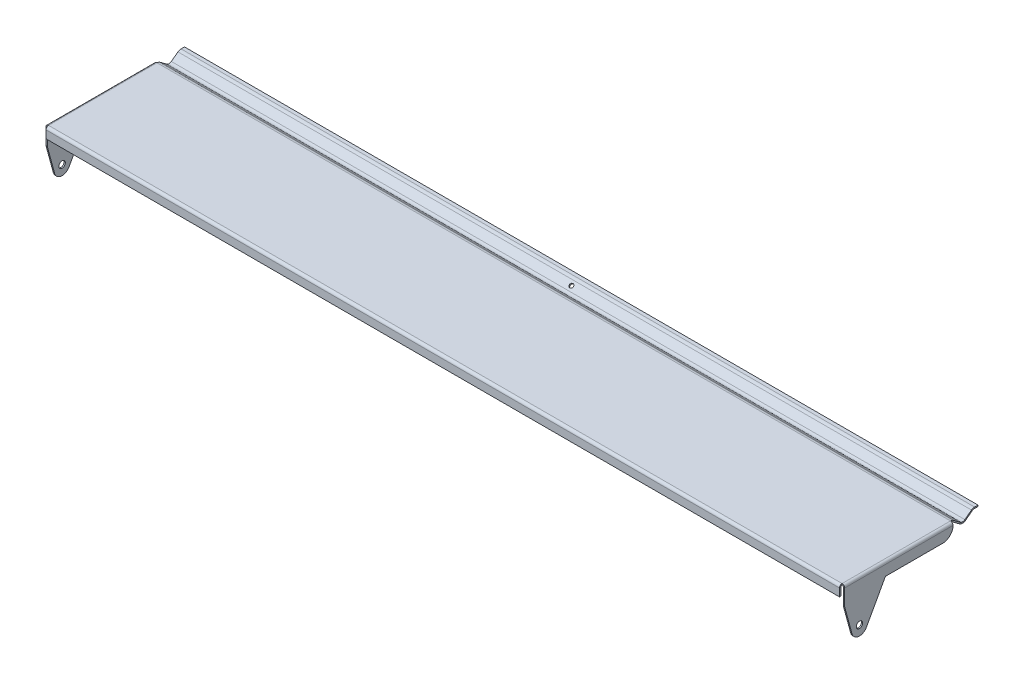
from build123d import *

# Parameters (mm, degrees)
SKETCH1_W                    = 615
SKETCH1_H                    = 105
BASE_FLANGE1_DEPTH           = 1
EDGE_FLANGE1_STRIP_W         = 6
EDGE_FLANGE1_STRIP_H         = 1
EDGE_FLANGE1_STRIP_CUT_DEPTH = 615
EDGE_FLANGE1_DEPTH           = 615
SKETCH16_W                   = 615
SKETCH16_H                   = 196.52545168
CUT_EXTRUDE1_DEPTH           = 10
SWEPT_START                  = -307.5
SWEPT_FLANGE1_DEPTH          = 615
EDGE_FLANGE2_DEPTH           = 84
EDGE_FLANGE2_BEND_DEPTH      = 84
CUT_EXTRUDE2_DEPTH           = 623.622700982
CUT_EXTRUDE2_DEPTH_BACK      = 623.622700982
SKETCH39_R                   = 2.5
FILLET1_R                    = 8
SKETCH45_R                   = 1.5
CUT_EXTRUDE3_DEPTH           = 10


# Read off the part's stored shape, not the designer's step: Swept Flange1
# Sheet-metal steps are written as plain solids
with BuildPart() as part:
    # Sketch1 → Base-Flange1 (new body)
    with BuildSketch(Plane(origin=(0, 0, 0), x_dir=(1, 0, 0), z_dir=(0, 1, 0))):
        Rectangle(SKETCH1_W, SKETCH1_H)
    extrude(amount=-BASE_FLANGE1_DEPTH)

    # Edge-Flange1 strip (across the edge) → Edge-Flange1 strip cut (cut)
    with BuildSketch(Plane(origin=(307.5, -1, 52.5), x_dir=(0, 0, -1), z_dir=(-1, 0, 0))):
        with Locations((-2, -0.5)):
            Rectangle(EDGE_FLANGE1_STRIP_W, EDGE_FLANGE1_STRIP_H)
    extrude(amount=EDGE_FLANGE1_STRIP_CUT_DEPTH, mode=Mode.SUBTRACT)

    # Edge-Flange1 section (across the edge) → Edge-Flange1 (add)
    with BuildSketch(Plane(origin=(307.5, -1, 52.5), x_dir=(0, 0, -1), z_dir=(-1, 0, 0))):
        with BuildLine():
            Line((-1, 1), (-1, 7))
            Line((-1, 7), (0, 7))
            Line((0, 7), (0, 1))
            ThreePointArc((0, 1), (0.292893219, 0.292893219), (1, 0))
            Line((1, 0), (1, -1))
            ThreePointArc((1, -1), (-0.414213562, -0.414213562), (-1, 1))
        make_face()
    extrude(amount=EDGE_FLANGE1_DEPTH)

    # Sketch16 → Cut-Extrude1 (cut)
    with BuildSketch(Plane(origin=(0, 0, 0), x_dir=(1, 0, 0), z_dir=(0, 1, 0))):
        with Locations((0, 130.76272584)):
            Rectangle(SKETCH16_W, SKETCH16_H)
    extrude(amount=-CUT_EXTRUDE1_DEPTH, mode=Mode.SUBTRACT)

    # Swept Flange1 outline → Swept Flange1 (add)
    with BuildSketch(Plane.YZ.offset(SWEPT_START)):
        with BuildLine():
            Line((-1, -51.166666667), (-1, -53.833333333))
            Line((-1, -53.833333333), (0, -53.833333333))
            Line((0, -53.833333333), (0, -51.166666667))
            ThreePointArc((0, -51.166666667), (-0.205266808, -49.901755603), (-0.8, -48.766666667))
            Line((-0.8, -48.766666667), (-4.65, -43.633333333))
            ThreePointArc((-4.65, -43.633333333), (-5.25, -41.833333333), (-4.65, -40.033333333))
            Line((-4.65, -40.033333333), (-0.8, -34.9))
            ThreePointArc((-0.8, -34.9), (-0.205266808, -33.764911064), (0, -32.5))
            Line((0, -32.5), (-1, -32.5))
            ThreePointArc((-1, -32.5), (-1.153950106, -33.448683298), (-1.6, -34.3))
            Line((-1.6, -34.3), (-5.45, -39.433333333))
            ThreePointArc((-5.45, -39.433333333), (-6.25, -41.833333333), (-5.45, -44.233333333))
            Line((-5.45, -44.233333333), (-1.6, -49.366666667))
            ThreePointArc((-1.6, -49.366666667), (-1.153950106, -50.217983369), (-1, -51.166666667))
        make_face()
    extrude(amount=SWEPT_FLANGE1_DEPTH)

    # Edge-Flange2 section (across the edge) → Edge-Flange2 (add)
    with BuildSketch(Plane(origin=(308.5, -1, -32.5), x_dir=(-1, 0, 0), z_dir=(0, 0, 1))):
        with BuildLine():
            Line((-1, 1), (-1, 39))
            Line((-1, 39), (0, 39))
            Line((0, 39), (0, 1))
            ThreePointArc((0, 1), (0.292893219, 0.292893219), (1, 0))
            Line((1, 0), (1, -1))
            ThreePointArc((1, -1), (-0.414213562, -0.414213562), (-1, 1))
        make_face()
    extrude(amount=EDGE_FLANGE2_DEPTH)

    # Edge-Flange2 section 2 (across the edge) → Edge-Flange2 bend (add)
    with BuildSketch(Plane(origin=(-308.5, -1, 51.5), x_dir=(1, 0, 0), z_dir=(0, 0, -1))):
        with BuildLine():
            Line((-1, 1), (-1, 39))
            Line((-1, 39), (0, 39))
            Line((0, 39), (0, 1))
            ThreePointArc((0, 1), (0.292893219, 0.292893219), (1, 0))
            Line((1, 0), (1, -1))
            ThreePointArc((1, -1), (-0.414213562, -0.414213562), (-1, 1))
        make_face()
    extrude(amount=EDGE_FLANGE2_BEND_DEPTH)

    # Sketch39 → Cut-Extrude2 (cut, two sides: drawn at the far end of the back side and taken through both)
    with BuildSketch(Plane.ZY.offset(309.5).offset(-CUT_EXTRUDE2_DEPTH_BACK)):
        with Locations(Location((40, -32.5, 0), (0, 0, 90))):
            Circle(SKETCH39_R)
        with BuildLine():
            Line((-32.5, -10), (19.901558991, -10))
            Line((19.901558991, -10), (34.712752069, -36.876753821))
            ThreePointArc((34.712752069, -36.876753821), (36.929590525, -39.160869046), (40, -40))
            ThreePointArc((40, -40), (43.667304301, -38.758423068), (45.82614719, -35.544386433))
            Line((45.82614719, -35.544386433), (51.5, -14.63988364))
            Line((51.5, -14.63988364), (60.41713226, -14.63988364))
            Line((60.41713226, -14.63988364), (60.41713226, -59.649041705))
            Line((60.41713226, -59.649041705), (-51.871278106, -59.649041705))
            Line((-51.871278106, -59.649041705), (-51.871278106, -10))
            Line((-51.871278106, -10), (-32.5, -10))
        make_face()
    extrude(amount=CUT_EXTRUDE2_DEPTH + CUT_EXTRUDE2_DEPTH_BACK, mode=Mode.SUBTRACT)

    # Fillet1
    fillet1_edges = [part.edges().sort_by_distance(p)[0] for p in [
        (-309, -10, -32.5),
        (309, -10, -32.5),
    ]]
    fillet(fillet1_edges, radius=FILLET1_R)

    # Sketch45 → Cut-Extrude3 (cut)
    with BuildSketch(Plane(origin=(0, -23.92, -17.94), x_dir=(1, 0, 0), z_dir=(0, 0.7999999999999998, 0.6000000000000002))):
        with Locations(Location((0, 35.325, 0), (0, 0, 270))):
            Circle(SKETCH45_R)
    extrude(amount=-CUT_EXTRUDE3_DEPTH, mode=Mode.SUBTRACT)


solid = part.part
